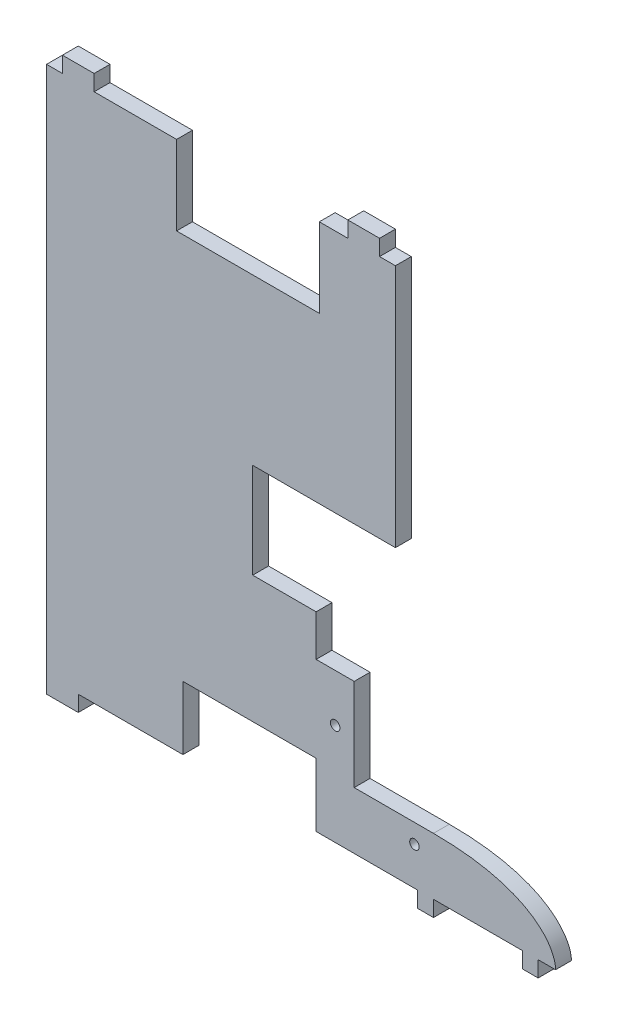
from build123d import *

# Parameters (mm, degrees)
ESQUISSE1_R        = 1.5
BOSS_EXTRU_1_DEPTH = 5
BOSS_EXTRU_2_DEPTH = 5


with BuildPart() as part:
    # Esquisse1 → Boss.-Extru.1 (new body)
    with BuildSketch(Plane.XY):
        Polygon((0, 0), (32, 0), (32, -5), (37, -5), (37, 0), (37, 18), (12, 18), (12, 47), (0, 47), align=None)
        with Locations((6, 32)):
            Circle(ESQUISSE1_R, mode=Mode.SUBTRACT)
        with Locations((31, 12)):
            Circle(ESQUISSE1_R, mode=Mode.SUBTRACT)
    extrude(amount=BOSS_EXTRU_1_DEPTH)

    # Esquisse2 → Boss.-Extru.2 (add)
    with BuildSketch(Plane(origin=(0, 0, 0), x_dir=(-1, 0, 0), z_dir=(0, 0, -1))):
        with BuildLine():
            Line((-37, 0), (-65, 0))
            Line((-65, 0), (-65, -5))
            Line((-65, -5), (-70, -5))
            Line((-70, -5), (-70, 0))
            Line((-70, 0), (-75.5, 0))
            add(Edge.make_bspline(
                [(-75.5, 0), (-75.5, 5.982232529), (-67.685409636, 18), (-37, 18)],
                knots=[0, 0, 0, 0, 1, 1, 1, 1], degree=3))
            Line((-37, 18), (-37, 0))
        make_face()
        Polygon((42, 0), (75, 0), (75, -5), (85, -5), (85, 167), (80, 167), (80, 172), (70, 172), (70, 167), (44, 167), (44, 142), (-1, 142), (-1, 167), (-10, 167), (-10, 172), (-20, 172), (-20, 167), (-25, 167), (-25, 90), (20, 90), (20, 60), (0, 60), (0, 20), (42, 20), align=None)
    extrude(amount=-BOSS_EXTRU_2_DEPTH)


solid = part.part
